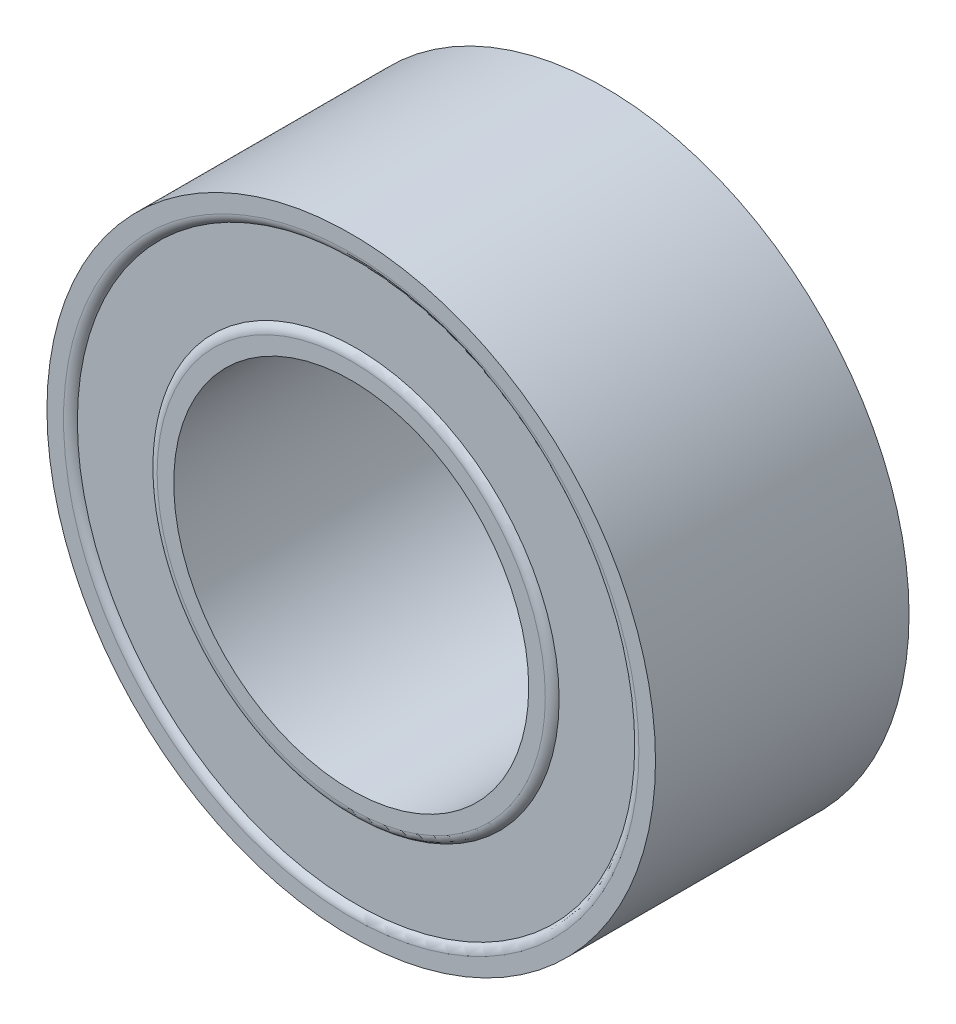
from build123d import *

# Parameters (mm, degrees)
SKETCH_1_R          = 6
SKETCH_1_R_2        = 3.5
EXTRUDE_1_DEPTH     = 2.5
SKETCH_2_R          = 5.5
SKETCH_2_R_2        = 4
CUT_EXTRUDE_1_DEPTH = 0.1
FILLET_1_R          = 0.2


with BuildPart() as part:
    # 草图1 → 凸台-拉伸1 (new, symmetric)
    with BuildSketch(Plane.XY):
        Circle(SKETCH_1_R)
        Circle(SKETCH_1_R_2, mode=Mode.SUBTRACT)
    extrude(amount=EXTRUDE_1_DEPTH, both=True)

    # 草图2 → 切除-拉伸1 (cut)
    with BuildSketch(Plane.XY.offset(2.5)):
        Circle(SKETCH_2_R)
        Circle(SKETCH_2_R_2, mode=Mode.SUBTRACT)
    cut_extrude_1 = extrude(amount=-CUT_EXTRUDE_1_DEPTH, mode=Mode.SUBTRACT)

    # 镜向1: 切除-拉伸1 across plane
    add(cut_extrude_1.mirror(Plane.XY), mode=Mode.SUBTRACT)

    # 圆角1
    # the kernel refuses this fillet: 0.2 mm, written as the material it takes off along each edge
    with BuildSketch(Plane(origin=(0, 0, 2.5), x_dir=(1, 0, 0), z_dir=(0, -1, 0))) as fillet_1_piece_1:
        with BuildLine():
            CenterArc((5.673205081, -0.2), FILLET_1_R, 90, 60)
            Line((5.5, -0.1), (5.496535898, -0.098))
            ThreePointArc((5.496535898, -0.098), (5.496, -0.05), (5.496, 0))
            Line((5.496, 0), (5.5, 0.004))
            Line((5.5, 0.004), (5.673205081, 0.004))
            Line((5.673205081, 0.004), (5.673205081, 0))
        make_face()
    revolve(axis=Axis((0, 0, 2.5), (0, 0, 1)), mode=Mode.SUBTRACT)
    with BuildSketch(Plane(origin=(0, 0, 2.5), x_dir=(1, 0, 0), z_dir=(0, -1, 0))) as fillet_1_piece_2:
        with BuildLine():
            CenterArc((3.826794919, -0.2), FILLET_1_R, 30, 60)
            Line((3.826794919, 0), (3.826794919, 0.004))
            Line((3.826794919, 0.004), (4, 0.004))
            Line((4, 0.004), (4.004, 0))
            ThreePointArc((4.004, 0), (4.004, -0.05), (4.003464102, -0.098))
            Line((4.003464102, -0.098), (4, -0.1))
        make_face()
    revolve(axis=Axis((0, 0, 2.5), (0, 0, 1)), mode=Mode.SUBTRACT)
    with BuildSketch(Plane(origin=(0, 0, -2.5), x_dir=(1, 0, 0), z_dir=(0, -1, 0))) as fillet_1_piece_3:
        with BuildLine():
            CenterArc((3.826794919, 0.2), FILLET_1_R, 270, 60)
            Line((3.826794919, 0), (3.826794919, -0.004))
            Line((3.826794919, -0.004), (4, -0.004))
            Line((4, -0.004), (4.004, 0))
            ThreePointArc((4.004, 0), (4.004, 0.05), (4.003464102, 0.098))
            Line((4.003464102, 0.098), (4, 0.1))
        make_face()
    revolve(axis=Axis((0, 0, -2.5), (0, 0, 1)), mode=Mode.SUBTRACT)
    with BuildSketch(Plane(origin=(0, 0, -2.5), x_dir=(1, 0, 0), z_dir=(0, -1, 0))) as fillet_1_piece_4:
        with BuildLine():
            CenterArc((5.673205081, 0.2), FILLET_1_R, 210, 60)
            Line((5.5, 0.1), (5.496535898, 0.098))
            ThreePointArc((5.496535898, 0.098), (5.496, 0.05), (5.496, 0))
            Line((5.496, 0), (5.5, -0.004))
            Line((5.5, -0.004), (5.673205081, -0.004))
            Line((5.673205081, -0.004), (5.673205081, 0))
        make_face()
    revolve(axis=Axis((0, 0, -2.5), (0, 0, 1)), mode=Mode.SUBTRACT)


solid = part.part
